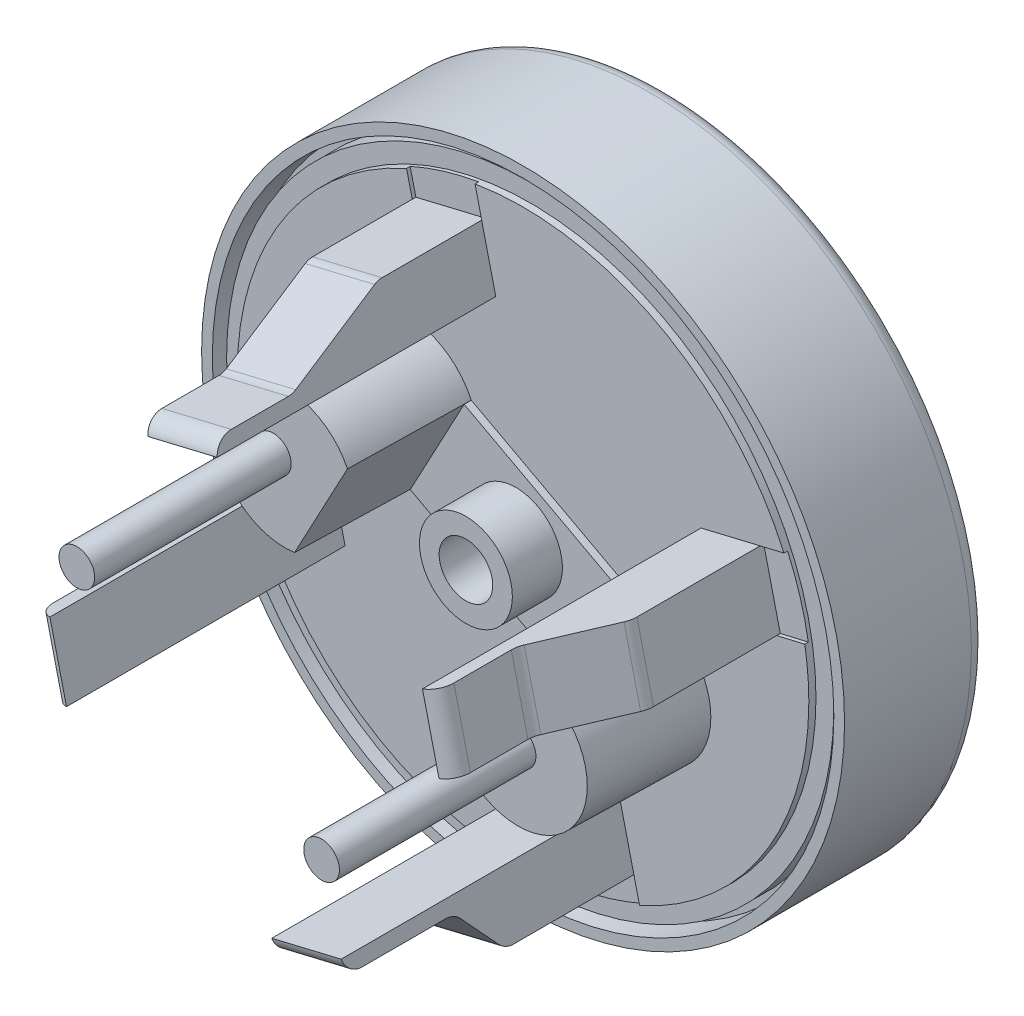
from build123d import *

# Parameters (mm, degrees)
ESQUISSE1_R                  = 9
BOSS_EXTRU_1_DEPTH           = 4
ESQUISSE2_R                  = 7
ENL_V_MAT_EXTRU_1_DEPTH      = 0.1
CONG_2_R                     = 0.45
ESQUISSE5_R                  = 8.7
ESQUISSE5_R_2                = 8.5
ENL_V_MAT_EXTRU_4_DEPTH      = 0.8
ESQUISSE6_R                  = 8.5
ESQUISSE6_R_2                = 8
ENL_V_MAT_EXTRU_5_DEPTH      = 0.2
ESQUISSE7_R                  = 1.3
BOSS_EXTRU_2_DEPTH           = 1.6
ESQUISSE8_R                  = 0.75
ENL_V_MAT_EXTRU_6_DEPTH      = 2
ENL_V_MAT_EXTRU_7_DEPTH      = 0.1
BOSS_EXTRU_4_DEPTH           = 7.8
ENL_V_MAT_EXTRU_9_DEPTH      = 18.685913522
ENL_V_MAT_EXTRU_10_DEPTH     = 7.8
ENL_V_MAT_EXTRU_11_DEPTH     = 7.8
ENL_V_MAT_EXTRU_12_DEPTH     = 7.8
CONG_4_R                     = 0.5
BOSS_EXTRU_5_DEPTH           = 0.2
BOSS_EXTRU_6_DEPTH           = 0.2
BOSS_EXTRU_7_DEPTH           = 3.4
BOSS_EXTRU_7_DRAFT           = 1
BOSS_EXTRU_7_PROFILE_2_DEPTH = 3.4
BOSS_EXTRU_7_PROFILE_2_DRAFT = 1
ESQUISSE22_R                 = 0.5
BOSS_EXTRU_8_DEPTH           = 5.5


with BuildPart() as part:
    # Esquisse1 → Boss.-Extru.1 (new body)
    with BuildSketch(Plane.XY):
        Circle(ESQUISSE1_R)
    extrude(amount=BOSS_EXTRU_1_DEPTH)

    # Esquisse2 → Enlèv. mat.-Extru.1 (cut)
    with BuildSketch(Plane(origin=(0, 0, 0), x_dir=(-1, 0, 0), z_dir=(0, 0, -1))):
        Circle(ESQUISSE2_R)
    extrude(amount=-ENL_V_MAT_EXTRU_1_DEPTH, mode=Mode.SUBTRACT)

    # Dôme1: read off the stored shape, not the designer's step
    # Dôme1 outline → Dôme1 (revolve)
    with BuildSketch(Plane.XZ):
        with BuildLine():
            Line((0, 0.100000007), (0, 0))
            ThreePointArc((0, 0), (3.500357247, 0.025001277), (7.000000245, 0.100000007))
            Line((7.000000245, 0.100000007), (0, 0.100000007))
        make_face()
    revolve(axis=Axis((0, 0, 0), (0, 0, 1)))

    # Congé2
    cong_2_edges = [part.edges().sort_by_distance(p)[0] for p in [
        (-9, 0, 0),
    ]]
    fillet(cong_2_edges, radius=CONG_2_R)

    # Esquisse5 → Enlèv. mat.-Extru.4 (cut)
    with BuildSketch(Plane.XY.offset(4)):
        Circle(ESQUISSE5_R)
        Circle(ESQUISSE5_R_2, mode=Mode.SUBTRACT)
    extrude(amount=-ENL_V_MAT_EXTRU_4_DEPTH, mode=Mode.SUBTRACT)

    # Esquisse6 → Enlèv. mat.-Extru.5 (cut)
    with BuildSketch(Plane.XY.offset(4)):
        Circle(ESQUISSE6_R)
        Circle(ESQUISSE6_R_2, mode=Mode.SUBTRACT)
    extrude(amount=-ENL_V_MAT_EXTRU_5_DEPTH, mode=Mode.SUBTRACT)

    # Esquisse7 → Boss.-Extru.2 (add)
    with BuildSketch(Plane.XY.offset(4)):
        Circle(ESQUISSE7_R)
    extrude(amount=BOSS_EXTRU_2_DEPTH)

    # Esquisse8 → Enlèv. mat.-Extru.6 (cut)
    with BuildSketch(Plane.XY.offset(5.6)):
        Circle(ESQUISSE8_R)
    extrude(amount=-ENL_V_MAT_EXTRU_6_DEPTH, mode=Mode.SUBTRACT)

    # Esquisse9 → Enlèv. mat.-Extru.7 (cut)
    with BuildSketch(Plane.XY.offset(4)):
        with BuildLine():
            Line((-3.101867345, 6.636401024), (-1.159258404, 7.099911513))
            Line((-1.159258404, 7.099911513), (-1.343718693, 7.886343898))
            ThreePointArc((-1.343718693, 7.886343898), (-2.320833, 7.655960697), (-3.261400396, 7.305016595))
            Line((-3.261400396, 7.305016595), (-3.101867345, 6.636401024))
        make_face()
        with BuildLine():
            Line((6.636401024, 3.101867345), (7.099911513, 1.159258404))
            Line((7.099911513, 1.159258404), (7.886343898, 1.343718693))
            ThreePointArc((7.886343898, 1.343718693), (7.655960697, 2.320833), (7.305016595, 3.261400396))
            Line((7.305016595, 3.261400396), (6.636401024, 3.101867345))
        make_face()
        with BuildLine():
            Line((3.101867345, -6.636401024), (1.159258404, -7.099911513))
            Line((1.159258404, -7.099911513), (1.343718693, -7.886343898))
            ThreePointArc((1.343718693, -7.886343898), (2.320833, -7.655960697), (3.261400396, -7.305016595))
            Line((3.261400396, -7.305016595), (3.101867345, -6.636401024))
        make_face()
        with BuildLine():
            Line((-6.636401024, -3.101867345), (-7.305016595, -3.261400396))
            ThreePointArc((-7.305016595, -3.261400396), (-7.655960697, -2.320833), (-7.886343898, -1.343718693))
            Line((-7.886343898, -1.343718693), (-7.099911513, -1.159258404))
            Line((-7.099911513, -1.159258404), (-6.636401024, -3.101867345))
        make_face()
    extrude(amount=-ENL_V_MAT_EXTRU_7_DEPTH, mode=Mode.SUBTRACT)

    # Esquisse10 → Boss.-Extru.4 (add)
    with BuildSketch(Plane.XY.offset(4)):
        Polygon((-6.636401024, -3.101867345), (-7.099911513, -1.159258404), (-5.446329973, -0.764710448), (-4.982819484, -2.707319388), align=None)
        Polygon((-3.101867345, 6.636401024), (-2.707319388, 4.982819484), (-0.764710448, 5.446329973), (-1.159258404, 7.099911513), align=None)
        Polygon((6.636401024, 3.101867345), (4.982819484, 2.707319388), (5.446329973, 0.764710448), (7.099911513, 1.159258404), align=None)
        Polygon((3.101867345, -6.636401024), (2.707319388, -4.982819484), (0.764710448, -5.446329973), (1.159258404, -7.099911513), align=None)
    extrude(amount=BOSS_EXTRU_4_DEPTH)

    # Esquisse11 → Enlèv. mat.-Extru.9 (cut, through all)
    with BuildSketch(Plane(origin=(-0.120729939, 0.505988675, 0), x_dir=(0.9726950236017893, 0.23208703337393644, 0), z_dir=(-0.23208703337393644, 0.9726950236017893, 0))):
        Polygon((-7.175097441, -11.8), (-7.175097441, -8.98351696), (-7.175097441, -7.6), (-5.875097441, -8.98351696), (-5.875097441, -11.8), align=None)
    extrude(amount=-ENL_V_MAT_EXTRU_9_DEPTH, mode=Mode.SUBTRACT)

    # Esquisse15 → Enlèv. mat.-Extru.10 (cut)
    with BuildSketch(Plane(origin=(0.505988675, 0.120729939, 0), x_dir=(0, 0, -1), z_dir=(0.9726950236017902, 0.232087033373933, 0))):
        Polygon((-9.6, 5.875097441), (-6.904775441, 7.175097441), (-7.6, 7.175097441), (-11.8, 7.175097441), (-11.8, 5.875097441), align=None)
    extrude(amount=-ENL_V_MAT_EXTRU_10_DEPTH, mode=Mode.SUBTRACT)

    # Esquisse16 → Enlèv. mat.-Extru.11 (cut)
    with BuildSketch(Plane(origin=(-0.505988675, -0.120729939, 0), x_dir=(0, 0, 1), z_dir=(-0.9726950236017917, -0.23208703337392622, 0))):
        Polygon((11.8, -5.875097441), (11.8, -7.175097441), (7.6, -7.175097441), (8.739344939, -5.875097441), align=None)
    extrude(amount=-ENL_V_MAT_EXTRU_11_DEPTH, mode=Mode.SUBTRACT)

    # Esquisse17 → Enlèv. mat.-Extru.12 (cut)
    with BuildSketch(Plane(origin=(0.120729939, -0.505988675, 0), x_dir=(0.9726950236017909, 0.2320870333739296, 0), z_dir=(0.2320870333739296, -0.9726950236017909, 0))):
        Polygon((7.175097441, 11.8), (5.875097441, 11.8), (5.875097441, 9.547824416), (7.175097441, 7.6), align=None)
    extrude(amount=-ENL_V_MAT_EXTRU_12_DEPTH, mode=Mode.SUBTRACT)

    # Congé4
    # the kernel refuses this fillet: 0.5 mm, written as the material it adds along each edge
    with BuildSketch(Plane(origin=(-0.857545261, 5.835407983, 9.6), x_dir=(0, 0, 1), z_dir=(-0.97269502360179, -0.23208703337393297, 0))) as cong_4_piece_1:
        with BuildLine():
            CenterArc((CONG_4_R * 0.228567915795, CONG_4_R), CONG_4_R, 244.250379429, 25.749620571)
            Line((-CONG_4_R * 0.205871376913, CONG_4_R * 0.0992988836737), (0, 0))
            Line((0, 0), (CONG_4_R * 0.228567915795, 0))
        make_face()
    extrude(amount=1.997140824)
    with BuildSketch(Plane(origin=(-5.835407983, -0.857545261, 8.98351696), x_dir=(-0.6660709221869021, -0.15892589207928975, -0.7287606516846885), z_dir=(0.23208703337393644, -0.9726950236017893, 0))) as cong_4_piece_2:
        with BuildLine():
            CenterArc((CONG_4_R * 0.396103711366, -CONG_4_R), CONG_4_R, 90, 43.217404507)
            Line((-CONG_4_R * 0.28866479883, -CONG_4_R * 0.271239348315), (0, 0))
            Line((0, 0), (CONG_4_R * 0.396103711366, 0))
        make_face()
    extrude(amount=1.997140824)
    with BuildSketch(Plane(origin=(0.857545261, -5.835407983, 8.739344939), x_dir=(0, 0, 1), z_dir=(0.9726950236017917, 0.23208703337392622, 0))) as cong_4_piece_3:
        with BuildLine():
            CenterArc((CONG_4_R * 0.453284010848, CONG_4_R), CONG_4_R, 221.231946302, 48.768053698)
            Line((-CONG_4_R * 0.298763516847, CONG_4_R * 0.340891119702), (0, 0))
            Line((0, 0), (CONG_4_R * 0.453284010848, 0))
        make_face()
    extrude(amount=1.997140824)
    with BuildSketch(Plane(origin=(5.835407983, 0.857545261, 9.547824416), x_dir=(0, 0, 1), z_dir=(-0.2320870333739296, 0.9726950236017909, 0))) as cong_4_piece_4:
        with BuildLine():
            CenterArc((CONG_4_R * 0.303056945208, CONG_4_R), CONG_4_R, 236.280406284, 33.719593716)
            Line((-CONG_4_R * 0.252071957179, CONG_4_R * 0.168235669354), (0, 0))
            Line((0, 0), (CONG_4_R * 0.303056945208, 0))
        make_face()
    extrude(amount=1.997140824)
    # the kernel refuses this fillet: 0.5 mm, written as the material it takes off along each edge
    with BuildSketch(Plane(origin=(-0.881349812, 7.166221075, 6.904775441), x_dir=(-3.0267422968955946e-12, 1.2685315190237014e-11, -1.0), z_dir=(-0.97269502360179, -0.23208703337393297, 0))) as cong_4_2_piece_1:
        with BuildLine():
            CenterArc((CONG_4_R * 0.228567915782, CONG_4_R), CONG_4_R, 244.25037943, 25.749620571)
            Line((-CONG_4_R * 0.205871376915, CONG_4_R * 0.0992988836686), (0, 0))
            Line((0, 0), (CONG_4_R * 0.228567915795, 0))
        make_face()
    extrude(amount=2.568560613, mode=Mode.SUBTRACT)
    with BuildSketch(Plane(origin=(0.333757981, 6.119655386, 11.8), x_dir=(0.2320870333739329, -0.9726950236017899, -1.5765166949672101e-12), z_dir=(-0.97269502360179, -0.23208703337393297, 0)), Plane(origin=(-0.333757981, -6.119655386, 11.8), x_dir=(-0.2320870333739262, 0.9726950236017916, -1.5587531265732232e-12), z_dir=(0.9726950236017917, 0.23208703337392622, 0)), Plane(origin=(6.119655386, -0.333757981, 11.8), x_dir=(-0.9726950236017908, -0.23208703337392958, -1.576516694967215e-12), z_dir=(-0.2320870333739296, 0.9726950236017909, 0))) as cong_4_2_piece_2:
        with BuildLine():
            CenterArc((0.5, -0.489897949), CONG_4_R, 101.536959033, 78.463040967)
            Line((0, -0.489897949), (0, 0))
            Line((0, 0), (0.4, 0))
        make_face()
    extrude(amount=4.446630567, mode=Mode.SUBTRACT)
    with BuildSketch(Plane(origin=(-6.119655386, 0.333757981, 11.8), x_dir=(0, 0, -1), z_dir=(0.23208703337393644, -0.9726950236017893, 0))) as cong_4_2_piece_3:
        with BuildLine():
            CenterArc((0.489897949, 0.5), CONG_4_R, 191.536959033, 78.463040967)
            Line((0, 0.4), (0, 0))
            Line((0, 0), (0.489897949, 0))
        make_face()
    extrude(amount=4.446630567, mode=Mode.SUBTRACT)
    with BuildSketch(Plane(origin=(-7.214824682, -0.677648268, 7.6), x_dir=(0, 0, -1), z_dir=(0.23208703337393644, -0.9726950236017893, 0))) as cong_4_2_piece_4:
        with BuildLine():
            CenterArc((CONG_4_R * 0.396103711366, CONG_4_R), CONG_4_R, 226.782595493, 43.217404507)
            Line((-CONG_4_R * 0.28866479883, CONG_4_R * 0.271239348315), (0, 0))
            Line((0, 0), (CONG_4_R * 0.396103711366, 0))
        make_face()
    extrude(amount=2.987400102, mode=Mode.SUBTRACT)
    with BuildSketch(Plane(origin=(0.608124527, -7.23141319, 7.6), x_dir=(1.338594444706181e-12, -5.610154673694855e-12, -1.0), z_dir=(0.9726950236017917, 0.23208703337392622, 0))) as cong_4_2_piece_5:
        with BuildLine():
            CenterArc((CONG_4_R * 0.453284010843, CONG_4_R), CONG_4_R, 221.231946302, 48.768053698)
            Line((-CONG_4_R * 0.29876351685, CONG_4_R * 0.340891119699), (0, 0))
            Line((0, 0), (CONG_4_R * 0.453284010848, 0))
        make_face()
    extrude(amount=3.130350851, mode=Mode.SUBTRACT)
    with BuildSketch(Plane(origin=(7.187830998, 0.790780926, 7.6), x_dir=(1.7990455545703256e-11, 4.292559697886523e-12, -1.0), z_dir=(-0.2320870333739296, 0.9726950236017909, 0))) as cong_4_2_piece_6:
        with BuildLine():
            CenterArc((CONG_4_R * 0.30305694519, CONG_4_R), CONG_4_R, 236.280406285, 33.719593716)
            Line((-CONG_4_R * 0.252071957184, CONG_4_R * 0.168235669346), (0, 0))
            Line((0, 0), (CONG_4_R * 0.303056945208, 0))
        make_face()
    extrude(amount=2.754783187, mode=Mode.SUBTRACT)

    # Esquisse19 → Boss.-Extru.5 (add)
    with BuildSketch(Plane.XY.offset(4)):
        Polygon((-1.45007978, 2.589839499), (2.959081769, 0.232023891), (1.45007978, -2.589839499), (-2.959081769, -0.232023891), align=None)
    extrude(amount=BOSS_EXTRU_5_DEPTH)

    # Esquisse19<2> → Boss.-Extru.6 (add)
    with BuildSketch(Plane.XY.offset(4)):
        Polygon((-1.45007978, 2.589839499), (2.959081769, 0.232023891), (1.45007978, -2.589839499), (-2.959081769, -0.232023891), align=None)
    extrude(amount=BOSS_EXTRU_6_DEPTH)


with BuildPart() as boss_extru_7_tool:
    # Esquisse21 → Boss.-Extru.7 (with draft: the straight prism first)
    with BuildSketch(Plane.XY.offset(4)):
        with BuildLine():
            Line((2.959081769, 0.232023891), (1.45007978, -2.589839499))
            ThreePointArc((1.45007978, -2.589839499), (5.020809919, -2.684896859), (2.959081769, 0.232023891))
        make_face()
    extrude(amount=BOSS_EXTRU_7_DEPTH)
    # Boss.-Extru.7: the draft: its side faces are tilted about the plane it starts from
    boss_extru_7_sides = [boss_extru_7_tool.faces().sort_by_distance(p)[0] for p in [
        (2.204580774, -1.178907804, 5.7),
        (5.020809919, -2.684896859, 5.7),
    ]]
    draft(boss_extru_7_sides, Plane.XY.offset(4), BOSS_EXTRU_7_DRAFT)


with BuildPart() as part_1:
    add(part.part)

    # Boss.-Extru.7: add boss_extru_7_tool
    add(boss_extru_7_tool.part)


with BuildPart() as boss_extru_7_profile_2_tool:
    # Esquisse21 → Boss.-Extru.7 profile 2 (with draft: the straight prism first)
    with BuildSketch(Plane.XY.offset(4)):
        with BuildLine():
            ThreePointArc((-1.45007978, 2.589839499), (-5.032507992, 2.691152447), (-2.959081769, -0.232023891))
            Line((-2.959081769, -0.232023891), (-1.45007978, 2.589839499))
        make_face()
    extrude(amount=BOSS_EXTRU_7_PROFILE_2_DEPTH)
    # Boss.-Extru.7 profile 2: the draft: its side faces are tilted about the plane it starts from
    boss_extru_7_profile_2_sides = [boss_extru_7_profile_2_tool.faces().sort_by_distance(p)[0] for p in [
        (-2.204580774, 1.178907804, 5.7),
        (-5.032507992, 2.691152447, 5.7),
    ]]
    draft(boss_extru_7_profile_2_sides, Plane.XY.offset(4), BOSS_EXTRU_7_PROFILE_2_DRAFT)


with BuildPart() as part_2:
    add(part_1.part)

    # Boss.-Extru.7 profile 2: add boss_extru_7_profile_2_tool
    add(boss_extru_7_profile_2_tool.part)

    # Esquisse22 → Boss.-Extru.8 (add)
    with BuildSketch(Plane.XY.offset(7.4)):
        with Locations((3.259256733, -1.742899713)):
            Circle(ESQUISSE22_R)
        with Locations(Location((-3.592580313, 1.921145742, 0), (0, 0, 180))):
            Circle(ESQUISSE22_R)
    extrude(amount=BOSS_EXTRU_8_DEPTH)


solid = part_2.part
